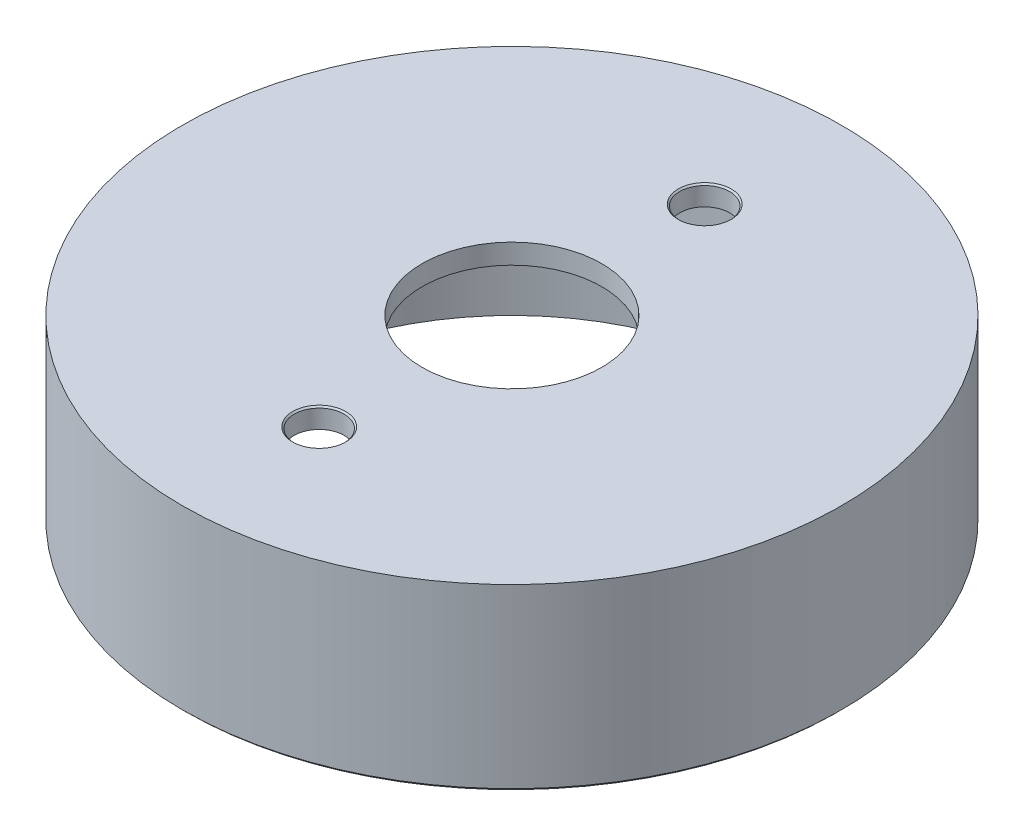
from build123d import *

# Parameters (mm, degrees)
SKETCH1_R           = 16.5
SKETCH1_R_2         = 12.73
BOSS_EXTRUDE1_DEPTH = 8
SKETCH2_R           = 16.5
BOSS_EXTRUDE2_DEPTH = 1
SKETCH3_R           = 1.25
SKETCH3_R_2         = 4.5
CUT_EXTRUDE1_DEPTH  = 9.65
SCALE1_SCALE        = 1.666666667
CHAMFER2_SIZE       = 0.125
CHAMFER4_SIZE       = 0.25


with BuildPart() as part:
    # Sketch1 → Boss-Extrude1 (new body)
    with BuildSketch(Plane(origin=(0, 0, 0), x_dir=(1, 0, 0), z_dir=(0, 1, 0))):
        Circle(SKETCH1_R)
        Circle(SKETCH1_R_2, mode=Mode.SUBTRACT)
    extrude(amount=BOSS_EXTRUDE1_DEPTH)

    # Sketch2 → Boss-Extrude2 (add)
    with BuildSketch(Plane(origin=(0, 8, 0), x_dir=(1, 0, 0), z_dir=(0, 1, 0))):
        Circle(SKETCH2_R)
    extrude(amount=BOSS_EXTRUDE2_DEPTH)

    # Sketch3 → Cut-Extrude1 (cut)
    with BuildSketch(Plane(origin=(0, 9, 0), x_dir=(1, 0, 0), z_dir=(0, 1, 0))):
        with Locations((0, 9.65)):
            Circle(SKETCH3_R)
        with Locations((0, -9.65)):
            Circle(SKETCH3_R)
        Circle(SKETCH3_R_2)
    extrude(amount=-CUT_EXTRUDE1_DEPTH, mode=Mode.SUBTRACT)


with BuildPart() as part_1:
    # Scale1: scaled about (0, 4.990699028, 0)
    add(part.part.scale(SCALE1_SCALE).moved(Location((0, -3.327132685, 0))))

    # Chamfer2
    chamfer2_edges = [part_1.edges().sort_by_distance(p)[0] for p in [
        (-2.083333333, 11.672867315, -16.083333333),
        (-2.083333333, 11.672867315, 16.083333333),
    ]]
    chamfer(chamfer2_edges, length=CHAMFER2_SIZE)

    # Chamfer4
    chamfer4_edges = [part_1.edges().sort_by_distance(p)[0] for p in [
        (-27.5, -3.327132685, 0),
    ]]
    chamfer(chamfer4_edges, length=CHAMFER4_SIZE)


solid = part_1.part
